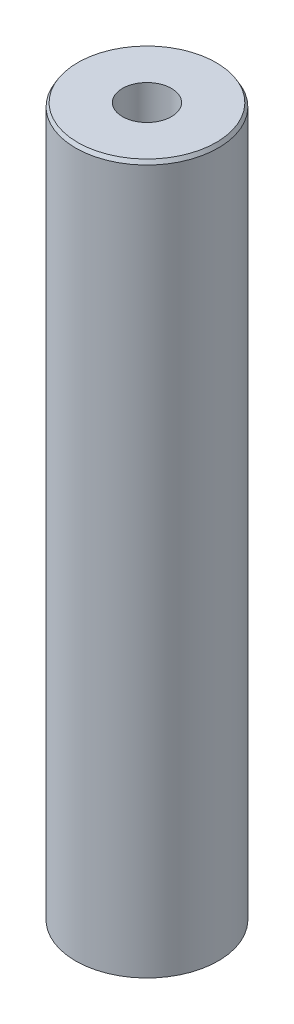
from build123d import *
from OCP.BRepFilletAPI import BRepFilletAPI_MakeChamfer

# Parameters (mm, degrees)
SKETCH1_R           = 10
BOSS_EXTRUDE1_DEPTH = 99.465647187
SKETCH2_R           = 3.432883989
CUT_EXTRUDE1_DEPTH  = 101.465989123
CHAMFER1_SIZE       = 0.519087287
CHAMFER1_SIZE2      = 0.299695185


with BuildPart() as part:
    # Sketch1 → Boss-Extrude1 (new body)
    with BuildSketch(Plane(origin=(0, 0, 0), x_dir=(1, 0, 0), z_dir=(0, 1, 0))):
        Circle(SKETCH1_R)
    extrude(amount=BOSS_EXTRUDE1_DEPTH)

    # Sketch2 → Cut-Extrude1 (cut, through all)
    with BuildSketch(Plane(origin=(0, 0, 0), x_dir=(1, 0, 0), z_dir=(0, 1, 0))):
        Circle(SKETCH2_R)
    extrude(amount=CUT_EXTRUDE1_DEPTH, mode=Mode.SUBTRACT)

    # Chamfer1: one chamfer whose edges measure the first distance from different faces: ONE call of the kernel's chamfer builder (chamfer() names one face for all edges)
    chamfer1_edges_1 = [part.edges().sort_by_distance(p)[0] for p in [
        (-10, 99.465647187, 0),
    ]]
    chamfer1_side_1 = [part.faces().sort_by_distance(p)[0] for p in [
        (-10, 49.732823594, 0),
    ]]
    chamfer1_edges_2 = [part.edges().sort_by_distance(p)[0] for p in [
        (-10, 0, 0),
    ]]
    chamfer1_side_2 = [part.faces().sort_by_distance(p)[0] for p in [
        (-9.717157288, 0, 0),
    ]]
    chamfer1 = BRepFilletAPI_MakeChamfer(part.part.solid().wrapped)
    for e in chamfer1_edges_1:
        chamfer1.Add(CHAMFER1_SIZE, CHAMFER1_SIZE2, e.wrapped, chamfer1_side_1[0].wrapped)  # the first distance lies on this face
    for e in chamfer1_edges_2:
        chamfer1.Add(CHAMFER1_SIZE, CHAMFER1_SIZE2, e.wrapped, chamfer1_side_2[0].wrapped)  # the first distance lies on this face
    add(Compound.cast(chamfer1.Shape()), mode=Mode.REPLACE)


solid = part.part
